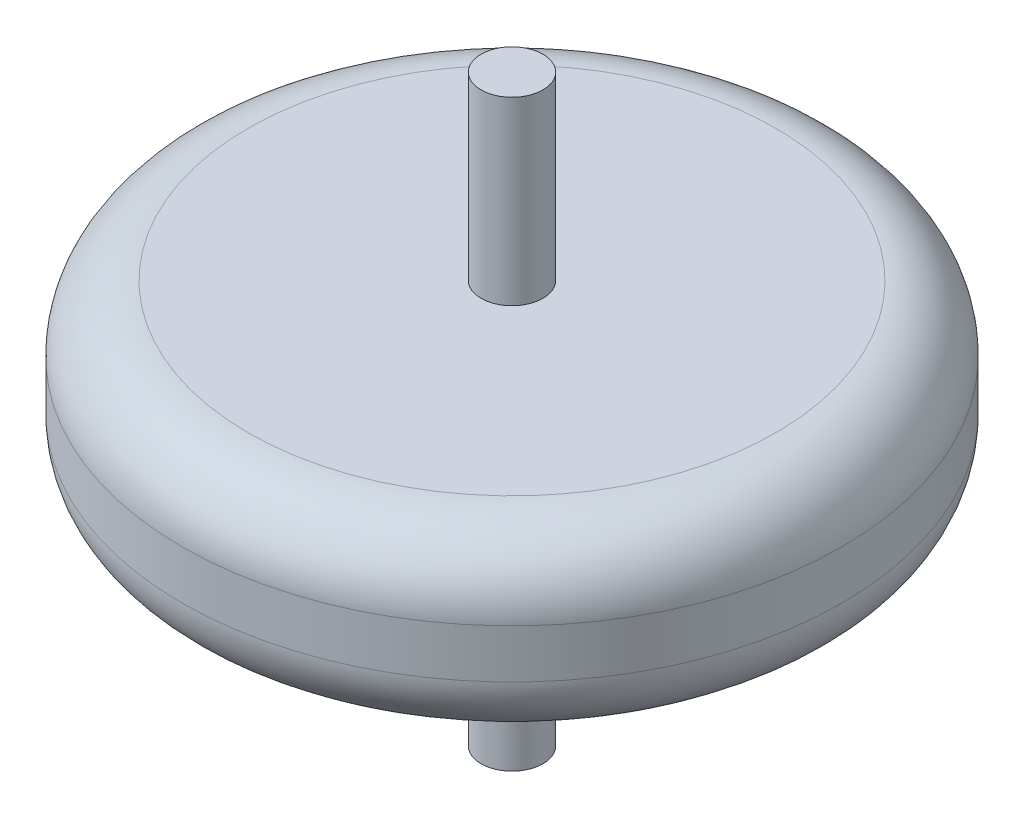
from build123d import *

# Parameters (mm, degrees)
SKETCH1_R                = 101.6
BOSS_EXTRUDE1_DEPTH      = 55.626
BOSS_EXTRUDE2_DEPTH      = 55.626
BOSS_EXTRUDE2_DEPTH_BACK = 124.206
SKETCH2_R                = 9.525
FILLET1_R                = 20.32


with BuildPart() as part:
    # Sketch1 → Boss-Extrude1 (new body)
    with BuildSketch(Plane(origin=(0, 0, 0), x_dir=(1, 0, 0), z_dir=(0, 1, 0))):
        Circle(SKETCH1_R)
    extrude(amount=BOSS_EXTRUDE1_DEPTH)

    # Sketch2 → Boss-Extrude2 (add, two sides: drawn at the far end of the back side and taken through both)
    with BuildSketch(Plane(origin=(0, 55.626, 0), x_dir=(1, 0, 0), z_dir=(0, 1, 0)).offset(-BOSS_EXTRUDE2_DEPTH_BACK)):
        Circle(SKETCH2_R)
    extrude(amount=BOSS_EXTRUDE2_DEPTH + BOSS_EXTRUDE2_DEPTH_BACK)

    # Fillet1
    fillet1_edges = [part.edges().sort_by_distance(p)[0] for p in [
        (-101.6, 0, 0),
        (-101.6, 55.626, 0),
    ]]
    fillet(fillet1_edges, radius=FILLET1_R)


solid = part.part
